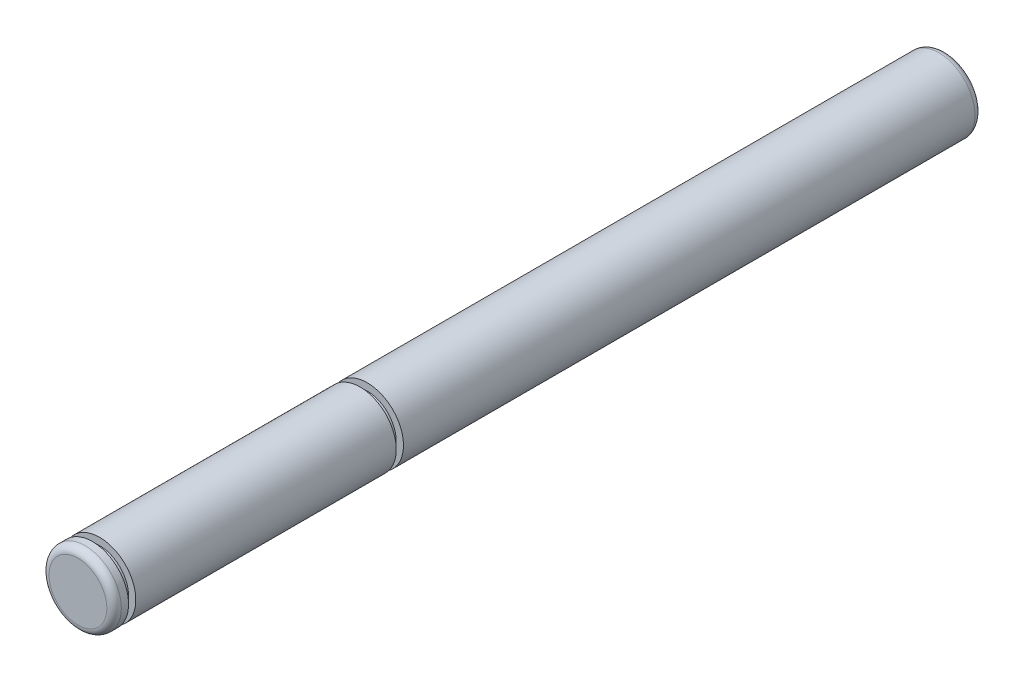
from build123d import *

# Parameters (mm, degrees)
SKETCH1_R           = 2.5
BOSS_EXTRUDE1_DEPTH = 30
SKETCH2_W           = 0.5
SKETCH2_H           = 0.5
FILLET1_R           = 0.5


with BuildPart() as part:
    # Sketch1 → Boss-Extrude1 (new, symmetric)
    with BuildSketch(Plane.XY):
        Circle(SKETCH1_R)
    extrude(amount=BOSS_EXTRUDE1_DEPTH, both=True)

    # Sketch2 → Cut-Revolve1 (revolve, cut)
    with BuildSketch(Plane(origin=(0, 0, 0), x_dir=(1, 0, 0), z_dir=(0, 1, 0))):
        with Locations((-2.25, -28.75)):
            Rectangle(SKETCH2_W, SKETCH2_H)
        with Locations((-2.25, -10.25)):
            Rectangle(SKETCH2_W, SKETCH2_H)
    revolve(axis=Axis((0, 0, 0), (0, 0, 1)), mode=Mode.SUBTRACT)

    # Fillet1
    fillet1_edges = [part.edges().sort_by_distance(p)[0] for p in [
        (-2.5, 0, -30),
        (-2.5, 0, 30),
    ]]
    fillet(fillet1_edges, radius=FILLET1_R)


solid = part.part
